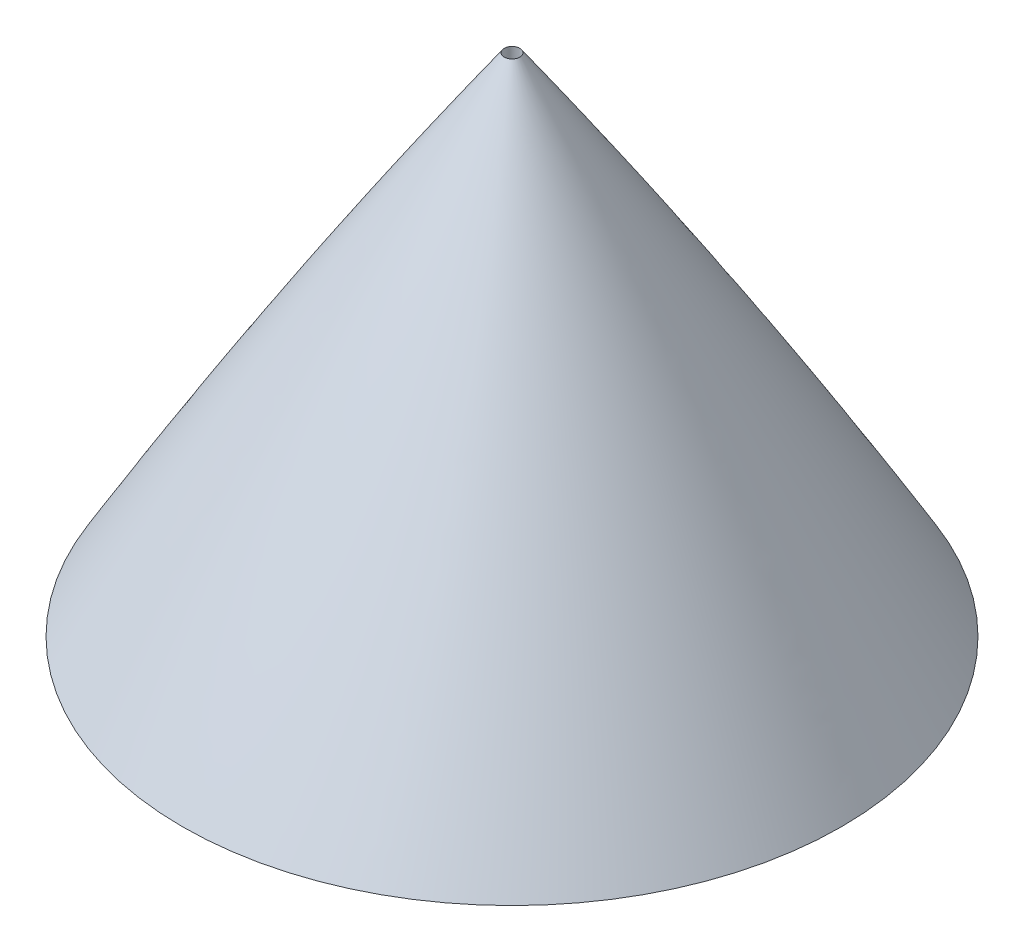
from build123d import *

# Parameters (mm, degrees)
BOSS_EXTRUDE1_START = -300
SKETCH2_R           = 71.2
SKETCH2_R_2         = 63.2
BOSS_EXTRUDE1_DEPTH = 300
SKETCH3_R           = 120.726600854
CUT_EXTRUDE1_DEPTH  = 532.182012996


with BuildPart() as part:
    # Sketch1 → Revolve3 (revolve)
    with BuildSketch(Plane.XY):
        with BuildLine():
            Line((81.2, 1.379280304), (81.2, 151.379280304))
            add(Edge.make_bspline(
                [(0.458845088, 400), (0.673401963, 399.690333083), (1.104372803, 399.066217371), (2.020510418, 397.734511806), (3.019890303, 396.266902311), (4.018705696, 394.78749875), (5.029784671, 393.277787143), (6.027183922, 391.775211896), (7.020082137, 390.266526534), (8.012400153, 388.745587271), (9.003942337, 387.212445439), (17.216413748, 374.401114323), (29.288927172, 353.640762456), (43.787909374, 324.197797089), (59.197647502, 283.600959805), (70.53347117, 243.590767812), (76.5329204, 210.855128163), (79.340922384, 185.61461754), (80.356271795, 170.883271894), (80.551575961, 167.669011288), (80.699779623, 164.924305749), (80.790427089, 163.110544887), (80.873405456, 161.306353258), (80.949151046, 159.504488838), (81.018023066, 157.688676909), (81.07900009, 155.905101954), (81.132620455, 154.129396489), (81.173709236, 152.514409555), (81.19167382, 151.755921894), (81.2, 151.379280304)],
                knots=[0.082616428, 0.082616428, 0.082616428, 0.082616428, 0.082616428, 0.088299706, 0.093982984, 0.099666263, 0.105349541, 0.111032819, 0.116716097, 0.122399375, 0.128082653, 0.133891142, 0.139699631, 0.313954311, 0.430124092, 0.546293874, 0.685697612, 0.836718331, 0.848335309, 0.865760775, 0.871569264, 0.877252541, 0.882935819, 0.888619096, 0.894302373, 0.899985651, 0.905668928, 0.911352205, 0.917035483, 0.917035483, 0.917035483, 0.917035483, 0.917035483], degree=4))
            Line((0.458845088, 400), (0.848609842, 381.403260181))
            add(Edge.make_bspline(
                [(0.848609842, 381.403260181), (0.972483681, 381.210414878), (4.012046949, 376.470723915), (12.61534185, 362.476241115), (30.634514435, 329.218929785), (51.072594149, 279.086014474), (64.005352458, 226.514540755), (68.975791336, 189.017325347), (70.327714732, 171.5213697), (70.767483552, 163.43018595), (70.919797499, 160.065394292), (71.01063312, 157.694079049), (71.057633605, 156.352656021), (71.090356272, 155.355600853), (71.121025656, 154.345633496), (71.151466626, 153.243553315), (71.174923151, 152.325510885), (71.190285212, 151.691977994), (71.196755056, 151.412340479), (71.2, 151.267877384)],
                knots=[0.132529096, 0.132529096, 0.132529096, 0.132529096, 0.134740989, 0.18686555, 0.291114672, 0.499612916, 0.70811116, 0.812360282, 0.864484843, 0.877515983, 0.890547124, 0.897062694, 0.900320479, 0.903578264, 0.906836049, 0.910093834, 0.913351619, 0.914980512, 0.916609404, 0.916609404, 0.916609404, 0.916609404], degree=3))
            Line((71.2, 151.267877384), (71.2, 1.379280304))
            Line((71.2, 1.379280304), (81.2, 1.379280304))
        make_face()
    revolve(axis=Axis((0, -198.817850362, 0), (0, -1, 0)))

    # Sketch2 → Boss-Extrude1 (add)
    with BuildSketch(Plane(origin=(0, 151.379280304, 0), x_dir=(1, 0, 0), z_dir=(0, 1, 0)).offset(BOSS_EXTRUDE1_START)):
        Circle(SKETCH2_R)
        Circle(SKETCH2_R_2, mode=Mode.SUBTRACT)
    extrude(amount=BOSS_EXTRUDE1_DEPTH)

    # Sketch3 → Cut-Extrude1 (cut, through all)
    with BuildSketch(Plane(origin=(0, 370, 0), x_dir=(-1, 0, 0), z_dir=(0, -1, 0))):
        Circle(SKETCH3_R)
    extrude(amount=CUT_EXTRUDE1_DEPTH, mode=Mode.SUBTRACT)


solid = part.part
